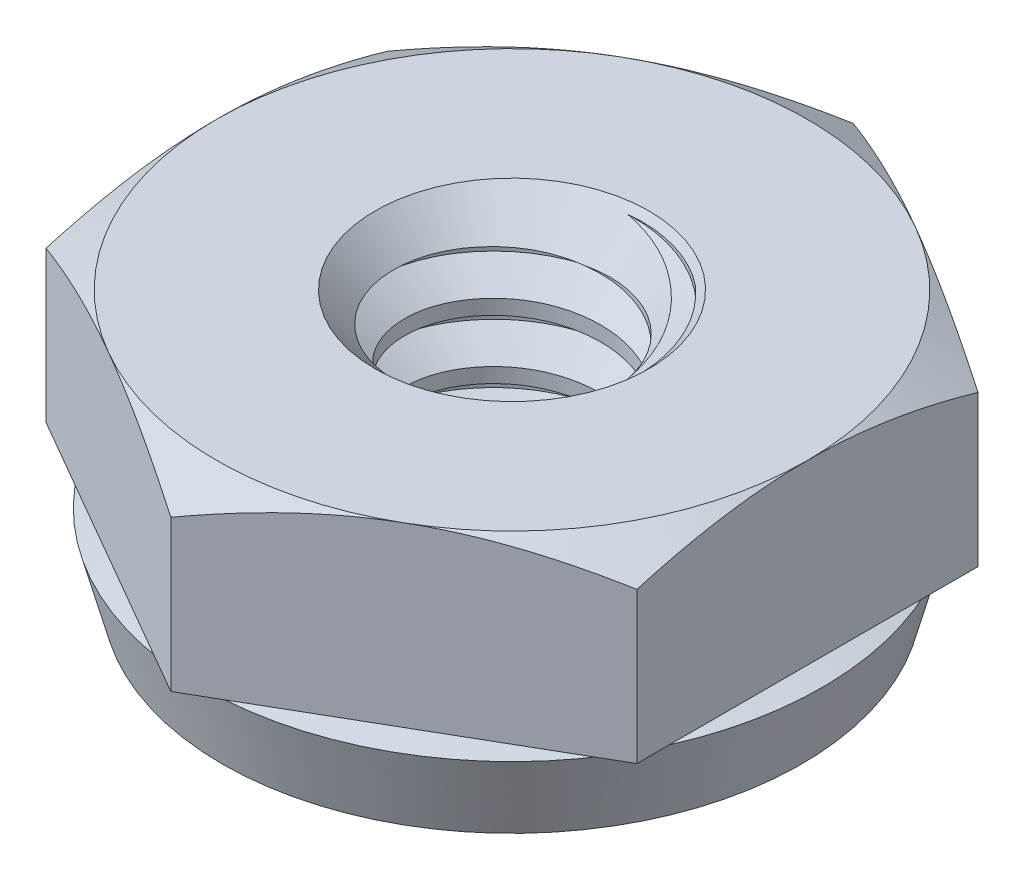
from build123d import *

# Parameters (mm, degrees)
BOSS_EXTRUDE1_DEPTH          = 3.571875
SKETCH2_OUTSIDE_W            = 40.304
SKETCH2_OUTSIDE_H            = 41.532
SKETCH2_OUTSIDE_R            = 3.96875
CUT_EXTRUDE1_DEPTH           = 8.036374753
CUT_EXTRUDE1_DRAFT           = -60
SKETCH4_R                    = 1.7526
CUT_EXTRUDE3_DEPTH           = 3.571875
SWEEP1_PITCH                 = 0.79375
SWEEP1_HEIGHT                = 4.365625
SWEEP1_RADIUS                = 1.7526
SKETCH7_R                    = 1.838525958
CUT_EXTRUDE4_OTHER_WAY_DEPTH = 8.48519566
CUT_EXTRUDE4_OTHER_WAY_TAPER = -45
SKETCH8_R                    = 1.838525958
CUT_EXTRUDE5_OTHER_WAY_DEPTH = 8.036374925
CUT_EXTRUDE5_OTHER_WAY_TAPER = -45
SKETCH9_W                    = 1.639492762
SKETCH9_H                    = 1.190625


with BuildPart() as part:
    # Sketch1 → Boss-Extrude1 (new body)
    with BuildSketch(Plane(origin=(0, 0, 0), x_dir=(1, 0, 0), z_dir=(0, 1, 0))):
        Polygon((0, 4.582717762), (-3.96875, 2.291358881), (-3.96875, -2.291358881), (0, -4.582717762), (3.96875, -2.291358881), (3.96875, 2.291358881), align=None)
    extrude(amount=BOSS_EXTRUDE1_DEPTH)


with BuildPart() as cut_extrude1_tool:
    # Sketch2 outside → Cut-Extrude1 (with draft: the straight prism first)
    with BuildSketch(Plane(origin=(0, 3.571875, 0), x_dir=(1, 0, 0), z_dir=(0, 1, 0))):
        Rectangle(SKETCH2_OUTSIDE_W, SKETCH2_OUTSIDE_H)
        Circle(SKETCH2_OUTSIDE_R, mode=Mode.SUBTRACT)
    extrude(amount=-CUT_EXTRUDE1_DEPTH)
    # Cut-Extrude1: the draft: its side faces are tilted about the plane it starts from
    cut_extrude1_sides = [cut_extrude1_tool.faces().sort_by_distance(p)[0] for p in [
        (0, -0.446312376, 20.766),
        (20.152, -0.446312376, 0),
        (0, -0.446312376, -20.766),
        (-20.152, -0.446312376, 0),
        (-3.96875, -0.446312376, 0),
    ]]
    draft(cut_extrude1_sides, Plane(origin=(0, 3.571875, 0), x_dir=(1, 0, 0), z_dir=(0, 1, 0)), CUT_EXTRUDE1_DRAFT)


with BuildPart() as part_1:
    add(part.part)

    # Cut-Extrude1: cut by cut_extrude1_tool
    add(cut_extrude1_tool.part, mode=Mode.SUBTRACT)

    # Sketch4 → Cut-Extrude3 (cut)
    with BuildSketch(Plane(origin=(0, 3.571875, 0), x_dir=(1, 0, 0), z_dir=(0, 1, 0))):
        with Locations(Location((0, 0, 0), (0, 0, 270))):
            Circle(SKETCH4_R)
    extrude(amount=-CUT_EXTRUDE3_DEPTH, mode=Mode.SUBTRACT)

    # Sweep1: sweep along a helix
    with BuildLine() as sweep1_path:
        Helix(SWEEP1_PITCH, SWEEP1_HEIGHT, SWEEP1_RADIUS, center=(0, 3.571875, 0), direction=(0, -1, 0))
    # Sketch6 → Sweep1 (sweep)
    with BuildSketch(Plane(origin=(0, 0, 0), x_dir=(0, 0, -1), z_dir=(1, 0, 0))):
        Polygon((1.795562979, 4.291210937), (1.32297021, 4.018359375), (1.32297021, 3.819921875), (1.795562979, 3.547070313), align=None)
    sweep(path=sweep1_path.line, is_frenet=True)

    # Cut-Extrude4 cone 1 section (through the dimple's axis) → Cut-Extrude4 (revolve, cut)
    with BuildSketch(Plane(origin=(0, 3.571875, 0), x_dir=(0, 0, 1), z_dir=(1, 0, 0))):
        Polygon((0, 0), (1.838525958, 0), (0, 1.838525958), align=None)
    revolve(axis=Axis((0, 3.571875, 0), (0, -1, 0)), mode=Mode.SUBTRACT)

    # Sketch7 → Cut-Extrude4 other way (cut)
    with BuildSketch(Plane(origin=(0, 3.571875, 0), x_dir=(1, 0, 0), z_dir=(0, 1, 0))):
        Circle(SKETCH7_R)
    extrude(amount=CUT_EXTRUDE4_OTHER_WAY_DEPTH, taper=CUT_EXTRUDE4_OTHER_WAY_TAPER, mode=Mode.SUBTRACT)

    # Cut-Extrude5 cone 1 section (through the dimple's axis) → Cut-Extrude5 (revolve, cut)
    with BuildSketch(Plane(origin=(0, 0, 0), x_dir=(0, 0, -1), z_dir=(1, 0, 0))):
        Polygon((0, 0), (1.838525958, 0), (0, 1.838525958), align=None)
    revolve(axis=Axis((0, 0, 0), (0, 1, 0)), mode=Mode.SUBTRACT)

    # Sketch8 → Cut-Extrude5 other way (cut)
    with BuildSketch(Plane.XZ):
        Circle(SKETCH8_R)
    extrude(amount=CUT_EXTRUDE5_OTHER_WAY_DEPTH, taper=CUT_EXTRUDE5_OTHER_WAY_TAPER, mode=Mode.SUBTRACT)

    # Sketch9 → Cut-Revolve1 (revolve, cut)
    with BuildSketch(Plane(origin=(0, 0, 0), x_dir=(0, 0, -1), z_dir=(1, 0, 0)), mode=Mode.PRIVATE) as cut_revolve1_sk:
        with Locations((3.762971381, 0.5953125)):
            Rectangle(SKETCH9_W, SKETCH9_H)
    revolve(cut_revolve1_sk.sketch.rotate(Axis((0, 0, 0), (0, 1, 0)), 301.134377146), axis=Axis((0, 0, 0), (0, 1, 0)), mode=Mode.SUBTRACT)

    # Sketch10 → Revolve1 (revolve)
    with BuildSketch(Plane(origin=(0, 0, 0), x_dir=(0, 0, -1), z_dir=(1, 0, 0)), mode=Mode.PRIVATE) as revolve1_sk:
        Polygon((2.943225, 1.190625), (3.565813342, 1.190625), (4.1671875, 1.02948728), (3.891337215, 0), (3.289963056, 0.16113772), (2.943225, 0.16113772), align=None)
    revolve(revolve1_sk.sketch.rotate(Axis((0, 1.190625, 0), (0, -1, 0)), 180), axis=Axis((0, 1.190625, 0), (0, -1, 0)))


solid = part_1.part
